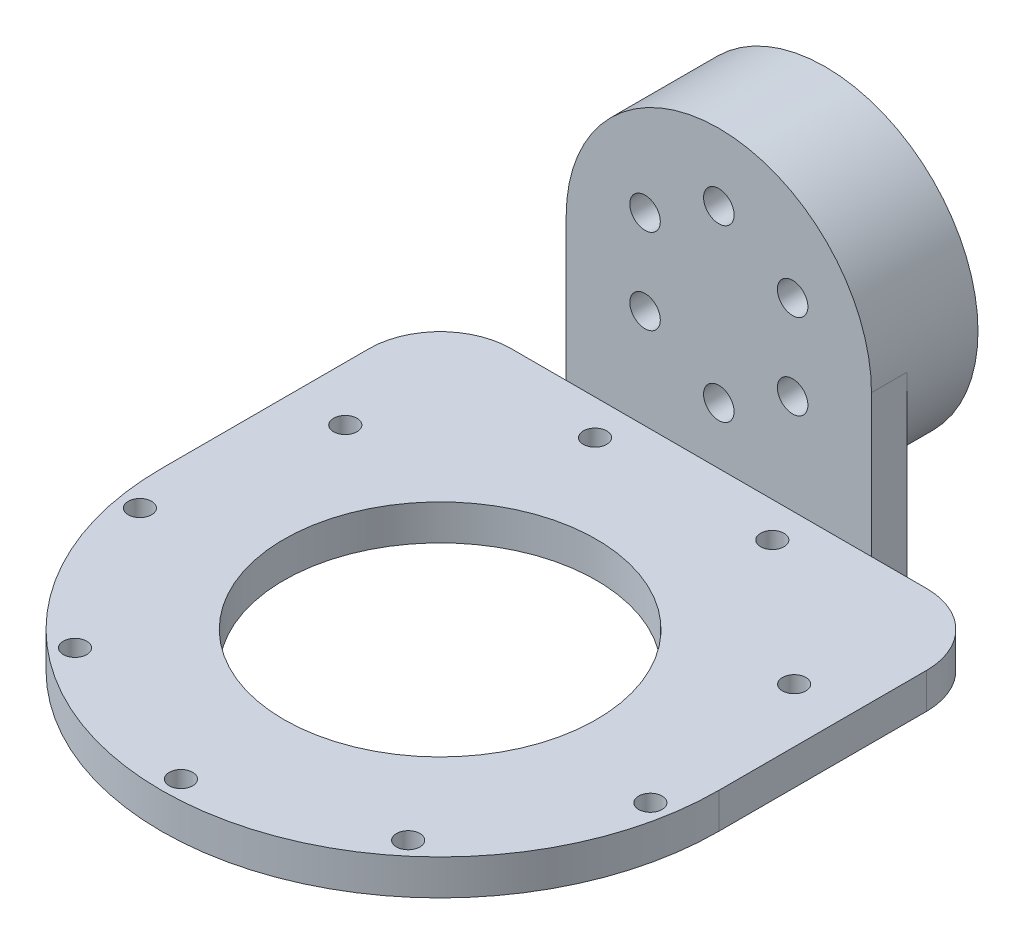
from build123d import *

# Parameters (mm, degrees)
SKETCH_1_R          = 21.5
EXTRUDE_1_DEPTH     = 10
EXTRUDE_2_DEPTH     = 5
EXTRUDE_3_DEPTH     = 5
FILLET_1_R          = 10
SKETCH_4_R          = 22
CUT_EXTRUDE_1_DEPTH = 110.56761611
SKETCH_5_R          = 1.65
CUT_EXTRUDE_2_DEPTH = 110.56761611
SKETCH_6_R          = 2.15
CUT_EXTRUDE_3_DEPTH = 92.256849058


with BuildPart() as part:
    # ｽｹｯﾁ1 → ﾎﾞｽ - 押し出し1 (new body)
    with BuildSketch(Plane.XY):
        Circle(SKETCH_1_R)
    extrude(amount=EXTRUDE_1_DEPTH)

    # ｽｹｯﾁ2 → ﾎﾞｽ - 押し出し2 (add)
    with BuildSketch(Plane.XY.offset(10)):
        with BuildLine():
            Line((-21.5, 0), (-21.5, -25))
            Line((-21.5, -25), (21.5, -25))
            Line((21.5, -25), (21.5, 0))
            ThreePointArc((21.5, 0), (0, 21.5), (-21.5, 0))
        make_face()
    extrude(amount=EXTRUDE_2_DEPTH)

    # ｽｹｯﾁ3 → ﾎﾞｽ - 押し出し3 (add)
    with BuildSketch(Plane.XZ.offset(25)):
        with BuildLine():
            Line((-39.25, 54.25), (-39.25, 15))
            Line((-39.25, 15), (39.25, 15))
            Line((39.25, 15), (39.25, 54.25))
            ThreePointArc((39.25, 54.25), (0, 93.5), (-39.25, 54.25))
        make_face()
    extrude(amount=-EXTRUDE_3_DEPTH)

    # ﾌｨﾚｯﾄ1
    fillet_1_edges = [part.edges().sort_by_distance(p)[0] for p in [
        (-39.25, -22.5, 15),
        (39.25, -22.5, 15),
    ]]
    fillet(fillet_1_edges, radius=FILLET_1_R)

    # ｽｹｯﾁ4 → ｶｯﾄ - 押し出し1 (cut, through all)
    with BuildSketch(Plane(origin=(0, -20, 0), x_dir=(1, 0, 0), z_dir=(0, 1, 0))):
        with Locations((0, -54.25)):
            Circle(SKETCH_4_R)
    extrude(amount=-CUT_EXTRUDE_1_DEPTH, mode=Mode.SUBTRACT)

    # ｽｹｯﾁ5 → ｶｯﾄ - 押し出し2 (cut, through all)
    with BuildSketch(Plane(origin=(0, -20, 0), x_dir=(1, 0, 0), z_dir=(0, 1, 0))):
        with Locations((0, -90.75)):
            Circle(SKETCH_5_R)
        with Locations((-23.461747754, -82.210622174)):
            Circle(SKETCH_5_R)
        with Locations((-35.945482985, -60.588158485)):
            Circle(SKETCH_5_R)
        with Locations((-31.609927238, -36)):
            Circle(SKETCH_5_R)
        with Locations((-12.483735231, -19.951219341)):
            Circle(SKETCH_5_R)
        with Locations((12.483735231, -19.951219341)):
            Circle(SKETCH_5_R)
        with Locations((31.609927238, -36)):
            Circle(SKETCH_5_R)
        with Locations((35.945482985, -60.588158485)):
            Circle(SKETCH_5_R)
        with Locations((23.461747754, -82.210622174)):
            Circle(SKETCH_5_R)
    extrude(amount=-CUT_EXTRUDE_2_DEPTH, mode=Mode.SUBTRACT)

    # ｽｹｯﾁ6 → ｶｯﾄ - 押し出し3 (cut, through all)
    with BuildSketch(Plane.XY.offset(15)):
        with Locations((0, 12)):
            Circle(SKETCH_6_R)
        with Locations((10.392304845, 6)):
            Circle(SKETCH_6_R)
        with Locations((10.392304845, -6)):
            Circle(SKETCH_6_R)
        with Locations((0, -12)):
            Circle(SKETCH_6_R)
        with Locations((-10.392304845, -6)):
            Circle(SKETCH_6_R)
        with Locations((-10.392304845, 6)):
            Circle(SKETCH_6_R)
    extrude(amount=-CUT_EXTRUDE_3_DEPTH, mode=Mode.SUBTRACT)


solid = part.part
